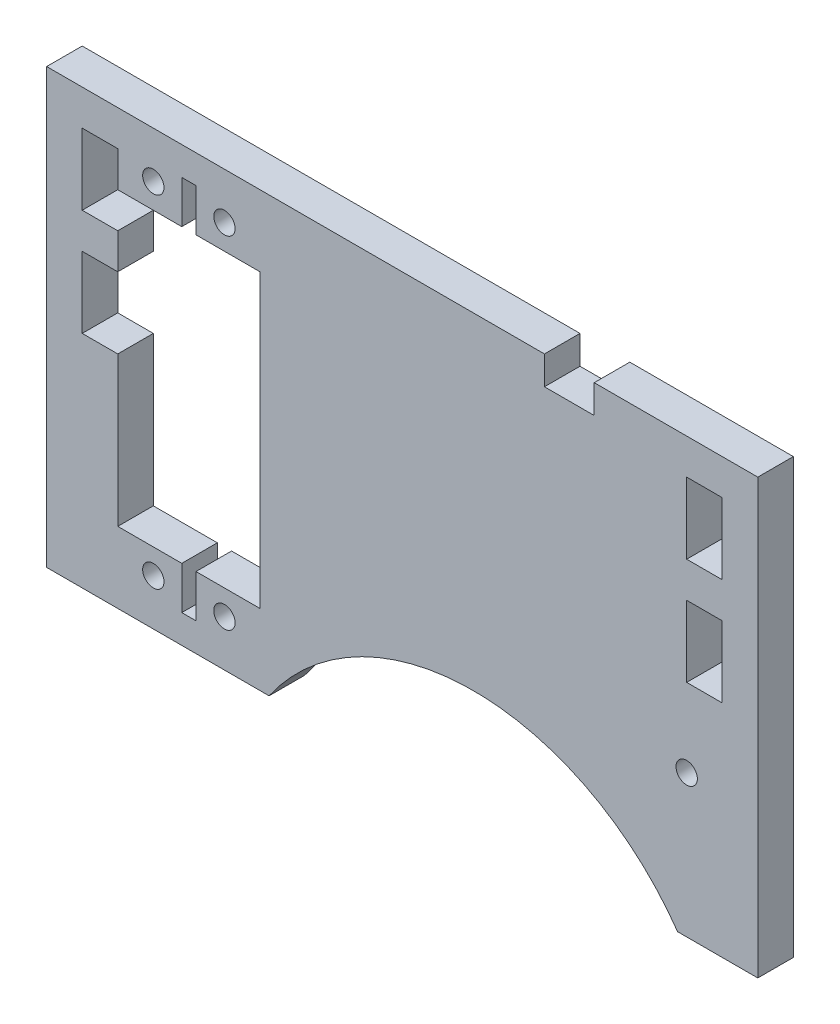
from build123d import *

# Parameters (mm, degrees)
ESQUISSE1_R        = 1.5
ESQUISSE1_W        = 5
ESQUISSE1_H        = 10
BOSS_EXTRU_1_DEPTH = 5


with BuildPart() as part:
    # Esquisse1 → Boss.-Extru.1 (new body)
    with BuildSketch(Plane.XY):
        with BuildLine():
            Line((0, 0), (31.277186767, 0))
            ThreePointArc((31.277186767, 0), (60, 15), (88.722813233, 0))
            Line((88.722813233, 0), (100, 0))
            Line((100, 0), (100, 61))
            Line((100, 61), (77, 61))
            Line((77, 61), (77, 57))
            Line((77, 57), (70, 57))
            Line((70, 57), (70, 61))
            Line((70, 61), (0, 61))
            Line((0, 61), (0, 0))
        make_face()
        with Locations((15, 6.5)):
            Circle(ESQUISSE1_R, mode=Mode.SUBTRACT)
        with Locations((25, 6.5)):
            Circle(ESQUISSE1_R, mode=Mode.SUBTRACT)
        with Locations((25, 54.5)):
            Circle(ESQUISSE1_R, mode=Mode.SUBTRACT)
        with Locations((15, 54.5)):
            Circle(ESQUISSE1_R, mode=Mode.SUBTRACT)
        with Locations((90, 20)):
            Circle(ESQUISSE1_R, mode=Mode.SUBTRACT)
        Polygon((10, 51), (19, 51), (19, 57), (21, 57), (21, 51), (30, 51), (30, 10), (21, 10), (21, 4), (19, 4), (19, 10), (10, 10), (10, 31), (5, 31), (5, 41), (10, 41), (10, 46), (5, 46), (5, 56), (10, 56), align=None, mode=Mode.SUBTRACT)
        with Locations((92.5, 51)):
            Rectangle(ESQUISSE1_W, ESQUISSE1_H, mode=Mode.SUBTRACT)
        with Locations((92.5, 36)):
            Rectangle(ESQUISSE1_W, ESQUISSE1_H, mode=Mode.SUBTRACT)
    extrude(amount=BOSS_EXTRU_1_DEPTH)


solid = part.part
